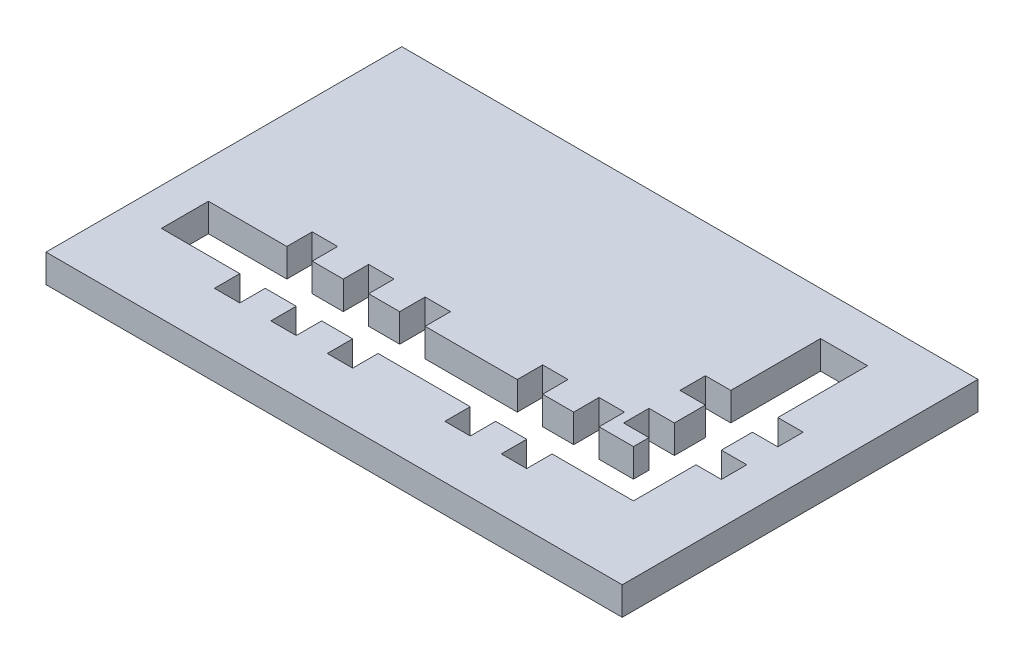
from build123d import *

# Parameters (mm, degrees)
SKETCH1_W           = 61.264005047
SKETCH1_H           = 37.827439358
BOSS_EXTRUDE1_DEPTH = 3


with BuildPart() as part:
    # Sketch1 → Boss-Extrude1 (new body)
    with BuildSketch(Plane(origin=(0, 0, 0), x_dir=(1, 0, 0), z_dir=(0, 1, 0))):
        with Locations((-2.672590825, 9.765235704)):
            Rectangle(SKETCH1_W, SKETCH1_H)
        Polygon((-21.016364466, 6.870025361), (-21.016364466, 4.170025361), (-29.351410774, 4.170025361), (-29.351410774, -0.829974639), (-21.016364466, -0.829974639), (-21.016364466, -3.529974639), (-18.316364466, -3.529974639), (-18.316364466, -0.829974639), (-15.016364466, -0.829974639), (-15.016364466, -3.529974639), (-12.316364466, -3.529974639), (-12.316364466, -0.829974639), (-9.016364385, -0.829974639), (-9.016364385, -3.529974639), (-6.316364385, -3.529974639), (-6.316364385, -0.829974639), (3.483635534, -0.829974639), (3.483635534, -3.529974639), (6.183635534, -3.529974639), (6.183635534, -0.829974639), (9.483635534, -0.829974639), (9.483635534, -3.529974639), (12.183635534, -3.529974639), (12.183635534, -0.829974639), (20.833635534, -0.829974639), (20.833635534, 4.170025361), (20.833635534, 5.820025361), (23.533635534, 5.820025361), (23.533635534, 8.520025361), (20.833635534, 8.520025361), (20.833635534, 11.820025361), (23.533635534, 11.820025361), (23.533635534, 14.520025361), (20.833635534, 14.520025361), (20.833635534, 24.062508058), (15.833635534, 24.062508058), (15.833635534, 14.520025361), (13.133635534, 14.520025361), (13.133635534, 11.820025361), (15.833635534, 11.820025361), (15.833635534, 8.520025361), (13.133635534, 8.520025361), (13.133635534, 5.820025361), (15.833635534, 5.820025361), (15.833635534, 4.170025361), (12.183635534, 4.170025361), (12.183635534, 6.870025361), (9.483635534, 6.870025361), (9.483635534, 4.170025361), (6.183635534, 4.170025361), (6.183635534, 6.870025361), (3.483635534, 6.870025361), (3.483635534, 4.170025361), (-6.316364385, 4.170025361), (-6.316364385, 6.870025361), (-9.016364385, 6.870025361), (-9.016364385, 4.170025361), (-12.316364385, 4.170025361), (-12.316364385, 6.870025361), (-15.016364466, 6.870025361), (-15.016364466, 4.170025361), (-18.316364466, 4.170025361), (-18.316364466, 6.870025361), align=None, mode=Mode.SUBTRACT)
    extrude(amount=BOSS_EXTRUDE1_DEPTH)


solid = part.part
